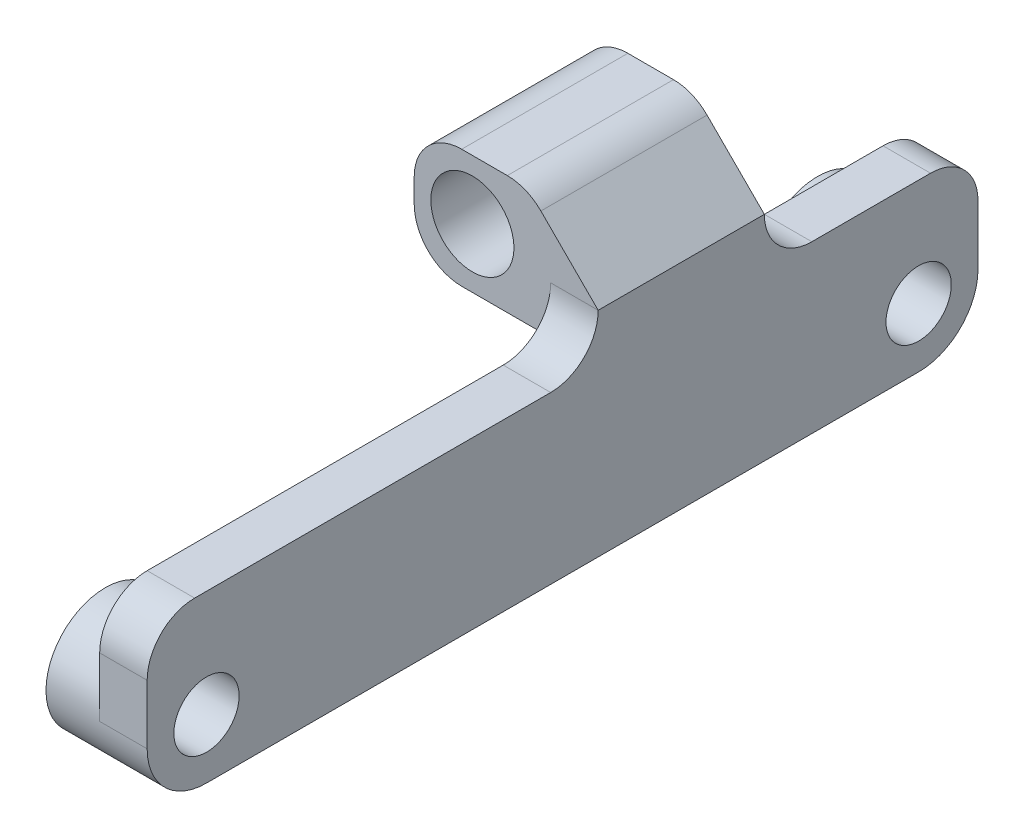
from build123d import *
from OCP.BRepFilletAPI import BRepFilletAPI_MakeChamfer

# Parameters (mm, degrees)
SKETCH1_R             = 5
BOSS_EXTRUDE1_DEPTH   = 5.1
BOSS_EXTRUDE1_2_DEPTH = 5.1
BOSS_EXTRUDE2_DEPTH   = 4
BOSS_EXTRUDE3_DEPTH   = 4
BOSS_EXTRUDE4_DEPTH   = 6
SKETCH5_R             = 3.5
CUT_EXTRUDE1_DEPTH    = 57.105347339
SKETCH7_R             = 2.75
CUT_EXTRUDE2_DEPTH    = 41.851070977
BOSS_EXTRUDE5_DEPTH   = 14
FILLET1_R             = 4
FILLET2_R             = 4
FILLET3_R             = 4
CHAMFER1_SIZE         = 1
CHAMFER1_SIZE2        = 0.577350269


with BuildPart() as part:
    # Sketch1 → Boss-Extrude1 (new body)
    with BuildSketch(Plane(origin=(0, 0, 0), x_dir=(0, 0, -1), z_dir=(1, 0, 0))):
        with Locations((30, 0)):
            Circle(SKETCH1_R)
    extrude(amount=BOSS_EXTRUDE1_DEPTH)



with BuildPart() as body_2:
    # Sketch1 → Boss-Extrude1 2 (new body)
    with BuildSketch(Plane(origin=(0, 0, 0), x_dir=(0, 0, -1), z_dir=(1, 0, 0))):
        with Locations((-30, 0)):
            Circle(SKETCH1_R)
    extrude(amount=BOSS_EXTRUDE1_2_DEPTH)


with BuildPart() as part_1:
    add(part.part)

    add(body_2.part)  # Boss-Extrude2 merges body 2
    # Sketch2 → Boss-Extrude2 (add)
    with BuildSketch(Plane(origin=(5.1, 0, 0), x_dir=(0, 0, -1), z_dir=(1, 0, 0))):
        with BuildLine():
            Line((30, -5), (-30, -5))
            ThreePointArc((-30, -5), (-33.535533906, -3.535533906), (-35, 0))
            Line((-35, 0), (-35, 5))
            Line((-35, 5), (-35, 9))
            Line((-35, 9), (35, 9))
            Line((35, 9), (35, 0))
            ThreePointArc((35, 0), (33.535533906, -3.535533906), (30, -5))
        make_face()
    extrude(amount=BOSS_EXTRUDE2_DEPTH)

    # Sketch3 → Boss-Extrude3 (add)
    with BuildSketch(Plane(origin=(0, 9, 0), x_dir=(1, 0, 0), z_dir=(0, 1, 0))):
        Polygon((5.1, 17), (-4.9, 17), (-6.4, 17), (-6.4, 3), (-4.9, 3), (9.1, 3), (9.1, 17), align=None)
    extrude(amount=BOSS_EXTRUDE3_DEPTH)

    # Sketch4 → Boss-Extrude4 (add)
    with BuildSketch(Plane(origin=(0, 13, 0), x_dir=(1, 0, 0), z_dir=(0, 1, 0))):
        Polygon((3.1, 17), (-6.4, 17), (-6.4, 3), (3.1, 3), (3.1, 10), align=None)
    extrude(amount=BOSS_EXTRUDE4_DEPTH)

    # Sketch5 → Cut-Extrude1 (cut, through all)
    with BuildSketch(Plane.XY.offset(-17)):
        with Locations(Location((-1.5, 14, 0), (0, 0, 180))):
            Circle(SKETCH5_R)
    extrude(amount=CUT_EXTRUDE1_DEPTH, mode=Mode.SUBTRACT)

    # Sketch7 → Cut-Extrude2 (cut, through all)
    with BuildSketch(Plane.ZY):
        with Locations((-30, 0)):
            Circle(SKETCH7_R)
        with Locations((30, 0)):
            Circle(SKETCH7_R)
    extrude(amount=-CUT_EXTRUDE2_DEPTH, mode=Mode.SUBTRACT)

    # Sketch8 → Boss-Extrude5 (add)
    with BuildSketch(Plane(origin=(0, 0, -17), x_dir=(-1, 0, 0), z_dir=(0, 0, -1))):
        Polygon((-9.1, 13), (-3.1, 19), (-3.1, 13), align=None)
    extrude(amount=-BOSS_EXTRUDE5_DEPTH)

    # Fillet1
    fillet1_edges = [part_1.edges().sort_by_distance(p)[0] for p in [
        (-6.4, 9, -10),
        (-6.4, 19, -10),
        (3.1, 19, -10),
    ]]
    fillet(fillet1_edges, radius=FILLET1_R - 0.0001)  # a hair under: the kernel refuses the full size

    # Fillet2
    fillet2_edges = [part_1.edges().sort_by_distance(p)[0] for p in [
        (7.1, 9, -3),
        (7.1, 9, -17),
    ]]
    fillet(fillet2_edges, radius=FILLET2_R)

    # Fillet3
    fillet3_edges = [part_1.edges().sort_by_distance(p)[0] for p in [
        (7.1, 9, -35),
        (7.1, 9, 35),
    ]]
    fillet(fillet3_edges, radius=FILLET3_R)

    # Chamfer1: one chamfer whose edges measure the first distance from different faces: ONE call of the kernel's chamfer builder (chamfer() names one face for all edges)
    chamfer1_edges_1 = [part_1.edges().sort_by_distance(p)[0] for p in [
        (0, 0, -25),
    ]]
    chamfer1_side_1 = [part_1.faces().sort_by_distance(p)[0] for p in [
        (0, 0, -25.141421356),
    ]]
    chamfer1_edges_2 = [part_1.edges().sort_by_distance(p)[0] for p in [
        (0, 0, 35),
    ]]
    chamfer1_side_2 = [part_1.faces().sort_by_distance(p)[0] for p in [
        (0, 0, 34.858578644),
    ]]
    chamfer1 = BRepFilletAPI_MakeChamfer(part_1.part.solid().wrapped)
    for e in chamfer1_edges_1:
        chamfer1.Add(CHAMFER1_SIZE, CHAMFER1_SIZE2, e.wrapped, chamfer1_side_1[0].wrapped)  # the first distance lies on this face
    for e in chamfer1_edges_2:
        chamfer1.Add(CHAMFER1_SIZE, CHAMFER1_SIZE2, e.wrapped, chamfer1_side_2[0].wrapped)  # the first distance lies on this face
    add(Compound.cast(chamfer1.Shape()), mode=Mode.REPLACE)


solid = part_1.part
